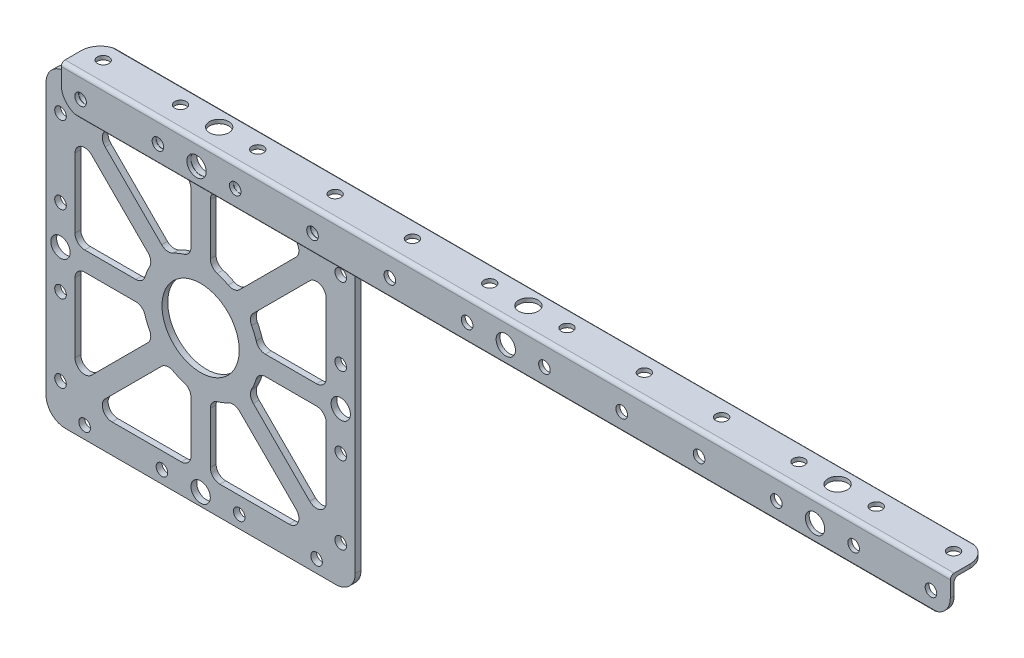
from build123d import *
from OCP.BRepAlgoAPI import BRepAlgoAPI_Cut
from OCP.TopTools import TopTools_ListOfShape

# Parameters (mm, degrees)
SALIENTE_EXTRUIR1_DEPTH    = 1.5
CROQUIS2_R                 = 10
CORTAR_EXTRUIR1_DEPTH      = 57.588426379
CROQUIS3_R                 = 1.5
CROQUIS3_R_2               = 2.5
CORTAR_EXTRUIR2_DEPTH      = 57.588426379
SALIENTE_EXTRUIR2_DEPTH    = 35
CORTAR_EXTRUIR3_DEPTH      = 58.587542056
CORTAR_EXTRUIR3_DEPTH_BACK = 58.587542056
CROQUIS4_R                 = 1.5
CROQUIS4_R_2               = 2.5
REDONDEO1_START            = -2
REDONDEO1_DEPTH            = 6
MATRIZC1_COUNT             = 2
MATRIZC1_ANGLE             = 90
SALIENTE_EXTRUIR3_DEPTH    = 70
CORTAR_EXTRUIR4_DEPTH      = 87.583846704
SALIENTE_EXTRUIR4_DEPTH    = 195
REDONDEO2_START            = -7.172182308
REDONDEO2_DEPTH            = 11.172182308
REDONDEO2_START_2          = 32.86663
REDONDEO2_2_DEPTH          = 11.13337
CROQUIS11_R                = 1.5
CROQUIS11_R_2              = 2.5
CORTAR_EXTRUIR5_DEPTH      = 1
CROQUIS12_R                = 1.5
CROQUIS12_R_2              = 2.5
CORTAR_EXTRUIR6_DEPTH      = 1


with BuildPart() as part:
    # Croquis1 → Saliente-Extruir1 (new body)
    with BuildSketch(Plane.XY):
        with BuildLine():
            Line((-35, -40), (35, -40))
            ThreePointArc((35, -40), (38.535533906, -38.535533906), (40, -35))
            Line((40, -35), (40, 35))
            ThreePointArc((40, 35), (38.535533906, 38.535533906), (35, 40))
            Line((35, 40), (-35, 40))
            ThreePointArc((-35, 40), (-38.535533906, 38.535533906), (-40, 35))
            Line((-40, 35), (-40, -35))
            ThreePointArc((-40, -35), (-38.535533906, -38.535533906), (-35, -40))
        make_face()
    extrude(amount=SALIENTE_EXTRUIR1_DEPTH)

    # Croquis2 → Cortar-Extruir1 (cut, through all)
    with BuildSketch(Plane.XY.offset(1.5)):
        Circle(CROQUIS2_R)
        with BuildLine():
            Line((2.5, 16.770509831), (2.5, 30))
            ThreePointArc((2.5, 30), (3.232233047, 31.767766953), (5, 32.5))
            Line((5, 32.5), (22.928932188, 32.5))
            ThreePointArc((22.928932188, 32.5), (25.238631019, 30.956708581), (24.696699141, 28.232233047))
            Line((24.696699141, 28.232233047), (10.090774273, 13.626308179))
            ThreePointArc((10.090774273, 13.626308179), (8.683931275, 12.920265539), (7.134006274, 13.194921541))
            ThreePointArc((7.134006274, 13.194921541), (5.740251485, 13.858192988), (4.285714286, 14.374722712))
            ThreePointArc((4.285714286, 14.374722712), (2.995540686, 15.27647407), (2.5, 16.770509831))
        make_face()
        with BuildLine():
            Line((-10.090774273, 13.626308179), (-24.696699141, 28.232233047))
            ThreePointArc((-24.696699141, 28.232233047), (-25.238631019, 30.956708581), (-22.928932188, 32.5))
            Line((-22.928932188, 32.5), (-5, 32.5))
            ThreePointArc((-5, 32.5), (-3.232233047, 31.767766953), (-2.5, 30))
            Line((-2.5, 30), (-2.5, 16.770509831))
            ThreePointArc((-2.5, 16.770509831), (-2.995540686, 15.27647407), (-4.285714286, 14.374722712))
            ThreePointArc((-4.285714286, 14.374722712), (-5.740251485, 13.858192988), (-7.134006274, 13.194921541))
            ThreePointArc((-7.134006274, 13.194921541), (-8.683931275, 12.920265539), (-10.090774273, 13.626308179))
        make_face()
        with BuildLine():
            Line((32.5, 5), (32.5, 22.928932188))
            ThreePointArc((32.5, 22.928932188), (30.956708581, 25.238631019), (28.232233047, 24.696699141))
            Line((28.232233047, 24.696699141), (13.626308179, 10.090774273))
            ThreePointArc((13.626308179, 10.090774273), (12.920265539, 8.683931275), (13.194921541, 7.134006274))
            ThreePointArc((13.194921541, 7.134006274), (13.858192988, 5.740251485), (14.374722712, 4.285714286))
            ThreePointArc((14.374722712, 4.285714286), (15.27647407, 2.995540686), (16.770509831, 2.5))
            Line((16.770509831, 2.5), (30, 2.5))
            ThreePointArc((30, 2.5), (31.767766953, 3.232233047), (32.5, 5))
        make_face()
        with BuildLine():
            Line((16.770509831, -2.5), (30, -2.5))
            ThreePointArc((30, -2.5), (31.767766953, -3.232233047), (32.5, -5))
            Line((32.5, -5), (32.5, -22.928932188))
            ThreePointArc((32.5, -22.928932188), (30.956708581, -25.238631019), (28.232233047, -24.696699141))
            Line((28.232233047, -24.696699141), (13.626308179, -10.090774273))
            ThreePointArc((13.626308179, -10.090774273), (12.920265539, -8.683931275), (13.194921541, -7.134006274))
            ThreePointArc((13.194921541, -7.134006274), (13.858192988, -5.740251485), (14.374722712, -4.285714286))
            ThreePointArc((14.374722712, -4.285714286), (15.27647407, -2.995540686), (16.770509831, -2.5))
        make_face()
        with BuildLine():
            Line((5, -32.5), (22.928932188, -32.5))
            ThreePointArc((22.928932188, -32.5), (25.238631019, -30.956708581), (24.696699141, -28.232233047))
            Line((24.696699141, -28.232233047), (10.090774273, -13.626308179))
            ThreePointArc((10.090774273, -13.626308179), (8.683931275, -12.920265539), (7.134006274, -13.194921541))
            ThreePointArc((7.134006274, -13.194921541), (5.740251485, -13.858192988), (4.285714286, -14.374722712))
            ThreePointArc((4.285714286, -14.374722712), (2.995540686, -15.27647407), (2.5, -16.770509831))
            Line((2.5, -16.770509831), (2.5, -30))
            ThreePointArc((2.5, -30), (3.232233047, -31.767766953), (5, -32.5))
        make_face()
        with BuildLine():
            Line((-2.5, -16.770509831), (-2.5, -30))
            ThreePointArc((-2.5, -30), (-3.232233047, -31.767766953), (-5, -32.5))
            Line((-5, -32.5), (-22.928932188, -32.5))
            ThreePointArc((-22.928932188, -32.5), (-25.238631019, -30.956708581), (-24.696699141, -28.232233047))
            Line((-24.696699141, -28.232233047), (-10.090774273, -13.626308179))
            ThreePointArc((-10.090774273, -13.626308179), (-8.683931275, -12.920265539), (-7.134006274, -13.194921541))
            ThreePointArc((-7.134006274, -13.194921541), (-5.740251485, -13.858192988), (-4.285714286, -14.374722712))
            ThreePointArc((-4.285714286, -14.374722712), (-2.995540686, -15.27647407), (-2.5, -16.770509831))
        make_face()
        with BuildLine():
            Line((-32.5, -5), (-32.5, -22.928932188))
            ThreePointArc((-32.5, -22.928932188), (-30.956708581, -25.238631019), (-28.232233047, -24.696699141))
            Line((-28.232233047, -24.696699141), (-13.626308179, -10.090774273))
            ThreePointArc((-13.626308179, -10.090774273), (-12.920265539, -8.683931275), (-13.194921541, -7.134006274))
            ThreePointArc((-13.194921541, -7.134006274), (-13.858192988, -5.740251485), (-14.374722712, -4.285714286))
            ThreePointArc((-14.374722712, -4.285714286), (-15.27647407, -2.995540686), (-16.770509831, -2.5))
            Line((-16.770509831, -2.5), (-30, -2.5))
            ThreePointArc((-30, -2.5), (-31.767766953, -3.232233047), (-32.5, -5))
        make_face()
        with BuildLine():
            Line((-16.770509831, 2.5), (-30, 2.5))
            ThreePointArc((-30, 2.5), (-31.767766953, 3.232233047), (-32.5, 5))
            Line((-32.5, 5), (-32.5, 22.928932188))
            ThreePointArc((-32.5, 22.928932188), (-30.956708581, 25.238631019), (-28.232233047, 24.696699141))
            Line((-28.232233047, 24.696699141), (-13.626308179, 10.090774273))
            ThreePointArc((-13.626308179, 10.090774273), (-12.920265539, 8.683931275), (-13.194921541, 7.134006274))
            ThreePointArc((-13.194921541, 7.134006274), (-13.858192988, 5.740251485), (-14.374722712, 4.285714286))
            ThreePointArc((-14.374722712, 4.285714286), (-15.27647407, 2.995540686), (-16.770509831, 2.5))
        make_face()
    extrude(amount=-CORTAR_EXTRUIR1_DEPTH, mode=Mode.SUBTRACT)

    # Croquis3 → Cortar-Extruir2 (cut, through all)
    with BuildSketch(Plane.XY.offset(1.5)):
        with Locations((-36.25, 30)):
            Circle(CROQUIS3_R)
        with Locations((-36.25, 10)):
            Circle(CROQUIS3_R)
        with Locations((-36.25, -10)):
            Circle(CROQUIS3_R)
        with Locations((-36.25, -30)):
            Circle(CROQUIS3_R)
        with Locations(Location((36.25, -30, 0), (0, 0, 180))):
            Circle(CROQUIS3_R)
        with Locations(Location((36.25, -10, 0), (0, 0, 180))):
            Circle(CROQUIS3_R)
        with Locations(Location((36.25, 10, 0), (0, 0, 180))):
            Circle(CROQUIS3_R)
        with Locations(Location((36.25, 30, 0), (0, 0, 180))):
            Circle(CROQUIS3_R)
        with Locations((-36.25, 0)):
            Circle(CROQUIS3_R_2)
        with Locations(Location((36.25, 0, 0), (0, 0, 180))):
            Circle(CROQUIS3_R_2)
    extrude(amount=-CORTAR_EXTRUIR2_DEPTH, mode=Mode.SUBTRACT)


with BuildPart() as body_2:
    # Croquis5 → Saliente-Extruir2 (new, symmetric)
    with BuildSketch(Plane(origin=(0, 0, 0), x_dir=(0, 0, -1), z_dir=(1, 0, 0))):
        with BuildLine():
            Line((-1.55, 32.75), (-1.55, 40))
            ThreePointArc((-1.55, 40), (-1.476776695, 40.176776695), (-1.3, 40.25))
            Line((-1.3, 40.25), (-0.2, 40.25))
            ThreePointArc((-0.2, 40.25), (-0.023223305, 40.176776695), (0.05, 40))
            Line((0.05, 40), (0.05, 32.75))
            ThreePointArc((0.05, 32.75), (0.123223305, 32.573223305), (0.3, 32.5))
            Line((0.3, 32.5), (0.8, 32.5))
            ThreePointArc((0.8, 32.5), (0.976776695, 32.573223305), (1.05, 32.75))
            Line((1.05, 32.75), (1.05, 40.85))
            ThreePointArc((1.05, 40.85), (0.903553391, 41.203553391), (0.55, 41.35))
            Line((0.55, 41.35), (-2.05, 41.35))
            ThreePointArc((-2.05, 41.35), (-2.403553391, 41.203553391), (-2.55, 40.85))
            Line((-2.55, 40.85), (-2.55, 32.75))
            ThreePointArc((-2.55, 32.75), (-2.476776695, 32.573223305), (-2.3, 32.5))
            Line((-2.3, 32.5), (-1.8, 32.5))
            ThreePointArc((-1.8, 32.5), (-1.623223305, 32.573223305), (-1.55, 32.75))
        make_face()
    extrude(amount=SALIENTE_EXTRUIR2_DEPTH, both=True)


with BuildPart() as cortar_extruir3_tool:
    # Croquis4 → Cortar-Extruir3 (new, two sides: drawn at the far end of the back side and taken through both)
    with BuildSketch(Plane.XY.offset(1.5).offset(-CORTAR_EXTRUIR3_DEPTH_BACK)):
        with Locations(Location((-30, 36.75, 0), (0, 0, 180))):
            Circle(CROQUIS4_R)
        with Locations(Location((-10, 36.75, 0), (0, 0, 180))):
            Circle(CROQUIS4_R)
        with Locations(Location((10, 36.75, 0), (0, 0, 180))):
            Circle(CROQUIS4_R)
        with Locations(Location((30, 36.75, 0), (0, 0, 180))):
            Circle(CROQUIS4_R)
        with Locations(Location((10, -36.75, 0), (0, 0, 180))):
            Circle(CROQUIS4_R)
        with Locations(Location((30, -36.75, 0), (0, 0, 180))):
            Circle(CROQUIS4_R)
        with Locations(Location((-10, -36.75, 0), (0, 0, 180))):
            Circle(CROQUIS4_R)
        with Locations(Location((-30, -36.75, 0), (0, 0, 180))):
            Circle(CROQUIS4_R)
        with Locations(Location((0, 36.75, 0), (0, 0, 180))):
            Circle(CROQUIS4_R_2)
        with Locations(Location((0, -36.75, 0), (0, 0, 180))):
            Circle(CROQUIS4_R_2)
    extrude(amount=CORTAR_EXTRUIR3_DEPTH + CORTAR_EXTRUIR3_DEPTH_BACK)


with BuildPart() as part_1:
    add(part.part)

    # Cortar-Extruir3: cut by cortar_extruir3_tool
    add(cortar_extruir3_tool.part, mode=Mode.SUBTRACT)


with BuildPart() as body_2_1:
    add(body_2.part)

    # Cortar-Extruir3: cut by cortar_extruir3_tool
    add(cortar_extruir3_tool.part, mode=Mode.SUBTRACT)

    # Redondeo1: read off the stored shape, not the designer's step
    # Redondeo1 outline → Redondeo1 (cut)
    with BuildSketch(Plane.XY.offset(REDONDEO1_START)):
        with BuildLine():
            Line((-35, 32.5), (-30, 32.5))
            ThreePointArc((-30, 32.5), (-33.535533906, 33.964466094), (-35, 37.5))
            Line((-35, 37.5), (-35, 32.5))
        make_face()
        with BuildLine():
            ThreePointArc((35, 37.5), (33.535533906, 33.964466094), (30, 32.5))
            Line((30, 32.5), (35, 32.5))
            Line((35, 32.5), (35, 37.5))
        make_face()
    extrude(amount=REDONDEO1_DEPTH, mode=Mode.SUBTRACT)


with BuildPart() as matrizc1_1:
    # MatrizC1: pattern copy
    add(body_2_1.part.rotate(Axis((0, 40.8, 0.75), (1, 0, 0)), 1 * MATRIZC1_ANGLE / (MATRIZC1_COUNT - 1)))


with BuildPart() as body_2_2:
    add(body_2_1.part)

    # Combinar2: union MatrizC1_1
    add(matrizc1_1.part)

    # Croquis6 → Saliente-Extruir3 (add)
    with BuildSketch(Plane(origin=(35, 0, 0), x_dir=(0, 0, -1), z_dir=(1, 0, 0))):
        with BuildLine():
            Line((-2.55, 40.85), (-2.55, 41.6))
            ThreePointArc((-2.55, 41.6), (-2.257106781, 42.307106781), (-1.55, 42.6))
            Line((-1.55, 42.6), (-0.8, 42.6))
            Line((-0.8, 42.6), (-0.8, 40.85))
            Line((-0.8, 40.85), (-2.55, 40.85))
        make_face()
    extrude(amount=-SALIENTE_EXTRUIR3_DEPTH)

    # Croquis7 → Cortar-Extruir4 (cut, through all)
    with BuildSketch(Plane(origin=(35, 0, 0), x_dir=(0, 0, -1), z_dir=(1, 0, 0))):
        with BuildLine():
            Line((0.05, 37.5), (0.05, 39))
            ThreePointArc((0.05, 39), (0.342893219, 39.707106781), (1.05, 40))
            Line((1.05, 40), (2.55, 40))
            Line((2.55, 40), (2.55, 41.6))
            Line((2.55, 41.6), (-0.55, 41.6))
            ThreePointArc((-0.55, 41.6), (-1.257106781, 41.307106781), (-1.55, 40.6))
            Line((-1.55, 40.6), (-1.55, 37.5))
            Line((-1.55, 37.5), (0.05, 37.5))
        make_face()
    extrude(amount=-CORTAR_EXTRUIR4_DEPTH, mode=Mode.SUBTRACT)


with BuildPart() as cortar_extruir4_piece_1:
    # of the separate pieces the step leaves, piece 1, a body of its own (cortar_extruir4_pieces)
    add(body_2_2.part.solids().sort_by_distance((-35, 41.6, 0.55))[0])

    # Croquis10 → Saliente-Extruir4 (add)
    with BuildSketch(Plane(origin=(0, 0, 0), x_dir=(0, 0, -1), z_dir=(1, 0, 0))):
        with BuildLine():
            Line((7.55, 41.85), (7.55, 42.35))
            ThreePointArc((7.55, 42.35), (7.476776695, 42.526776695), (7.3, 42.6))
            Line((7.3, 42.6), (2.55, 42.6))
            Line((2.55, 42.6), (-1.55, 42.6))
            ThreePointArc((-1.55, 42.6), (-2.257106781, 42.307106781), (-2.55, 41.6))
            Line((-2.55, 41.6), (-2.55, 37.5))
            Line((-2.55, 37.5), (-2.55, 32.75))
            ThreePointArc((-2.55, 32.75), (-2.476776695, 32.573223305), (-2.3, 32.5))
            Line((-2.3, 32.5), (-1.8, 32.5))
            ThreePointArc((-1.8, 32.5), (-1.623223305, 32.573223305), (-1.55, 32.75))
            Line((-1.55, 32.75), (-1.55, 37.5))
            Line((-1.55, 37.5), (-1.55, 40.6))
            ThreePointArc((-1.55, 40.6), (-1.257106781, 41.307106781), (-0.55, 41.6))
            Line((-0.55, 41.6), (2.55, 41.6))
            Line((2.55, 41.6), (7.3, 41.6))
            ThreePointArc((7.3, 41.6), (7.476776695, 41.673223305), (7.55, 41.85))
        make_face()
    extrude(amount=SALIENTE_EXTRUIR4_DEPTH)


with BuildPart() as cortar_extruir4_piece_2:
    # of the separate pieces the step leaves, piece 2, a body of its own (cortar_extruir4_pieces)
    add(body_2_2.part.solids().sort_by_distance((-35, 40, -2.55))[0])


with BuildPart() as redondeo2_tool:
    # Redondeo2: read off the stored shape, not the designer's step
    # Redondeo2 outline → Redondeo2 (new body)
    with BuildSketch(Plane.XY.offset(REDONDEO2_START)):
        with BuildLine():
            ThreePointArc((195, 37.5), (193.535533906, 33.964466094), (190, 32.5))
            Line((190, 32.5), (195, 32.5))
            Line((195, 32.5), (195, 37.5))
        make_face()
    extrude(amount=REDONDEO2_DEPTH)


with BuildPart() as cortar_extruir4_piece_1_1:
    add(cortar_extruir4_piece_1.part)

    # Redondeo2: cut by redondeo2_tool, with a tolerance
    redondeo2_stock = TopTools_ListOfShape()
    redondeo2_stock.Append(cortar_extruir4_piece_1_1.part.wrapped)
    redondeo2_tools = TopTools_ListOfShape()
    redondeo2_tools.Append(redondeo2_tool.part.wrapped)
    redondeo2_cut = BRepAlgoAPI_Cut()
    redondeo2_cut.SetArguments(redondeo2_stock)
    redondeo2_cut.SetTools(redondeo2_tools)
    redondeo2_cut.SetFuzzyValue(0.00001)
    redondeo2_cut.Build()
    add(Compound.cast(redondeo2_cut.Shape()).solids(), mode=Mode.REPLACE)


with BuildPart() as redondeo2_2_tool:
    # Redondeo2 2 outline → Redondeo2 2 (new body)
    with BuildSketch(Plane(origin=(0, 0, 0), x_dir=(1, 0, 0), z_dir=(0, 1, 0)).offset(REDONDEO2_START_2)):
        with BuildLine():
            Line((195, 7.55), (190, 7.55))
            ThreePointArc((190, 7.55), (193.535533906, 6.085533906), (195, 2.55))
            Line((195, 2.55), (195, 7.55))
        make_face()
    extrude(amount=REDONDEO2_2_DEPTH)


with BuildPart() as cortar_extruir4_piece_1_2:
    add(cortar_extruir4_piece_1_1.part)

    # Redondeo2 2: cut by redondeo2_2_tool, with a tolerance
    redondeo2_2_stock = TopTools_ListOfShape()
    redondeo2_2_stock.Append(cortar_extruir4_piece_1_2.part.wrapped)
    redondeo2_2_tools = TopTools_ListOfShape()
    redondeo2_2_tools.Append(redondeo2_2_tool.part.wrapped)
    redondeo2_2_cut = BRepAlgoAPI_Cut()
    redondeo2_2_cut.SetArguments(redondeo2_2_stock)
    redondeo2_2_cut.SetTools(redondeo2_2_tools)
    redondeo2_2_cut.SetFuzzyValue(0.00001)
    redondeo2_2_cut.Build()
    add(Compound.cast(redondeo2_2_cut.Shape()).solids(), mode=Mode.REPLACE)

    # Croquis11 → Cortar-Extruir5 (cut)
    with BuildSketch(Plane(origin=(0, 42.6, 0), x_dir=(1, 0, 0), z_dir=(0, 1, 0))):
        with Locations((-30, 3.3)):
            Circle(CROQUIS11_R)
        with Locations((-10, 3.3)):
            Circle(CROQUIS11_R)
        with Locations(Location((10, 3.3, 0), (0, 0, 270))):
            Circle(CROQUIS11_R)
        with Locations(Location((30, 3.3, 0), (0, 0, 270))):
            Circle(CROQUIS11_R)
        with Locations(Location((50, 3.3, 0), (0, 0, 270))):
            Circle(CROQUIS11_R)
        with Locations(Location((70, 3.3, 0), (0, 0, 270))):
            Circle(CROQUIS11_R)
        with Locations(Location((90, 3.3, 0), (0, 0, 270))):
            Circle(CROQUIS11_R)
        with Locations(Location((110, 3.3, 0), (0, 0, 270))):
            Circle(CROQUIS11_R)
        with Locations(Location((130, 3.3, 0), (0, 0, 270))):
            Circle(CROQUIS11_R)
        with Locations(Location((150, 3.3, 0), (0, 0, 270))):
            Circle(CROQUIS11_R)
        with Locations(Location((170, 3.3, 0), (0, 0, 270))):
            Circle(CROQUIS11_R)
        with Locations(Location((190, 3.3, 0), (0, 0, 270))):
            Circle(CROQUIS11_R)
        with Locations((0, 3.3)):
            Circle(CROQUIS11_R_2)
        with Locations(Location((80, 3.3, 0), (0, 0, 270))):
            Circle(CROQUIS11_R_2)
        with Locations(Location((160, 3.3, 0), (0, 0, 270))):
            Circle(CROQUIS11_R_2)
    extrude(amount=-CORTAR_EXTRUIR5_DEPTH, mode=Mode.SUBTRACT)

    # Croquis12 → Cortar-Extruir6 (cut)
    with BuildSketch(Plane.XY.offset(2.55)):
        with Locations((-30, 36.75)):
            Circle(CROQUIS12_R)
        with Locations((-10, 36.75)):
            Circle(CROQUIS12_R)
        with Locations((10, 36.75)):
            Circle(CROQUIS12_R)
        with Locations((30, 36.75)):
            Circle(CROQUIS12_R)
        with Locations((50, 36.75)):
            Circle(CROQUIS12_R)
        with Locations((70, 36.75)):
            Circle(CROQUIS12_R)
        with Locations((90, 36.75)):
            Circle(CROQUIS12_R)
        with Locations((110, 36.75)):
            Circle(CROQUIS12_R)
        with Locations((130, 36.75)):
            Circle(CROQUIS12_R)
        with Locations((150, 36.75)):
            Circle(CROQUIS12_R)
        with Locations((170, 36.75)):
            Circle(CROQUIS12_R)
        with Locations((190, 36.75)):
            Circle(CROQUIS12_R)
        with Locations((0, 36.75)):
            Circle(CROQUIS12_R_2)
        with Locations((80, 36.75)):
            Circle(CROQUIS12_R_2)
        with Locations((160, 36.75)):
            Circle(CROQUIS12_R_2)
    extrude(amount=-CORTAR_EXTRUIR6_DEPTH, mode=Mode.SUBTRACT)


solid = Compound([part_1.part, cortar_extruir4_piece_1_2.part])
